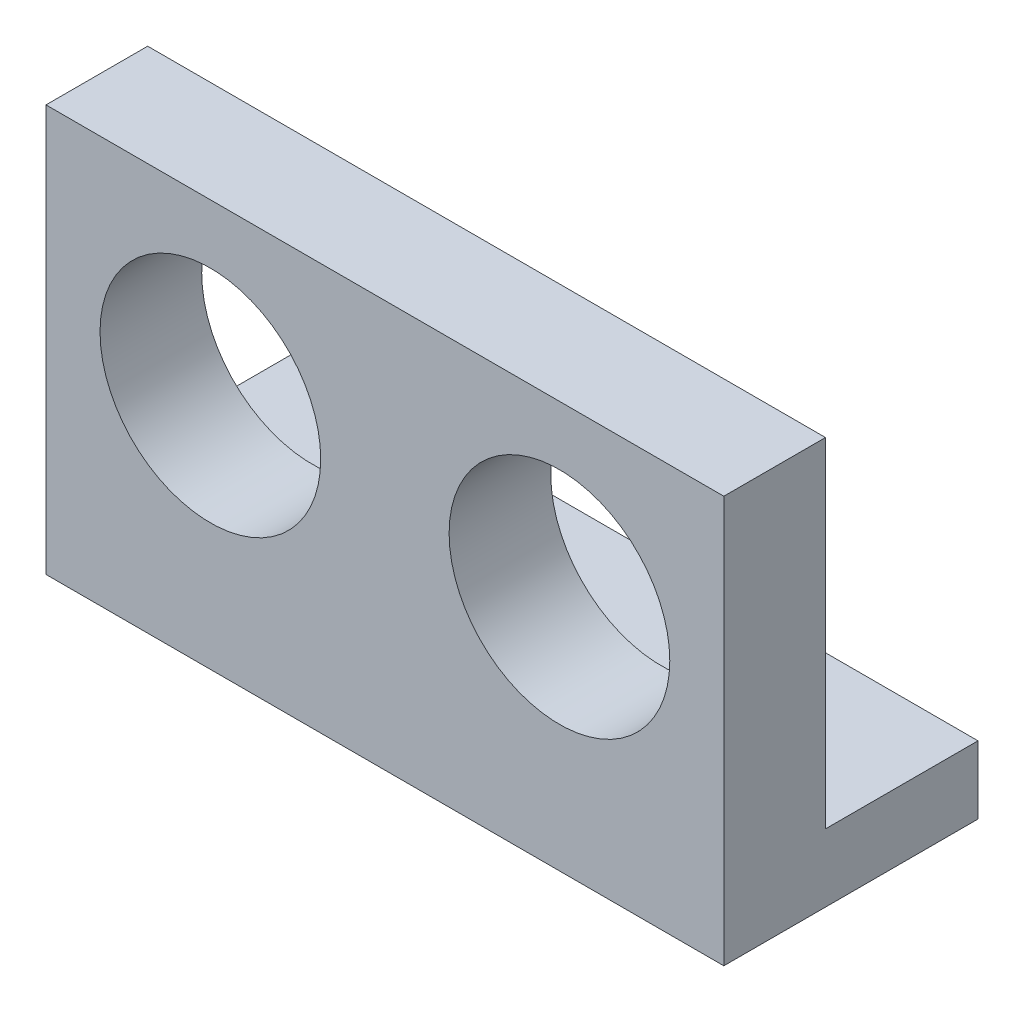
from build123d import *

# Parameters (mm, degrees)
SKETCH12_W          = 50.8
SKETCH12_H          = 25.4
BOSS_EXTRUDE1_DEPTH = 7.62
SKETCH11_R          = 8.2696685
CUT_EXTRUDE2_DEPTH  = 37.720354029
SKETCH14_W          = 50.8
SKETCH14_H          = 19.05
BOSS_EXTRUDE2_DEPTH = 5.08


with BuildPart() as part:
    # Sketch12 → Boss-Extrude1 (new body)
    with BuildSketch(Plane.XY):
        with Locations((0, 12.7)):
            Rectangle(SKETCH12_W, SKETCH12_H)
    extrude(amount=BOSS_EXTRUDE1_DEPTH)

    # Sketch11 → Cut-Extrude2 (cut, through all)
    with BuildSketch(Plane.XY):
        with Locations((13.081, 12.7)):
            Circle(SKETCH11_R)
        with Locations((-13.081, 12.7)):
            Circle(SKETCH11_R)
    extrude(amount=CUT_EXTRUDE2_DEPTH, mode=Mode.SUBTRACT)

    # Sketch14 → Boss-Extrude2 (add)
    with BuildSketch(Plane(origin=(0, 0, 0), x_dir=(-1, 0, 0), z_dir=(0, -1, 0))):
        with Locations((0, 1.905)):
            Rectangle(SKETCH14_W, SKETCH14_H)
    extrude(amount=BOSS_EXTRUDE2_DEPTH)


solid = part.part
